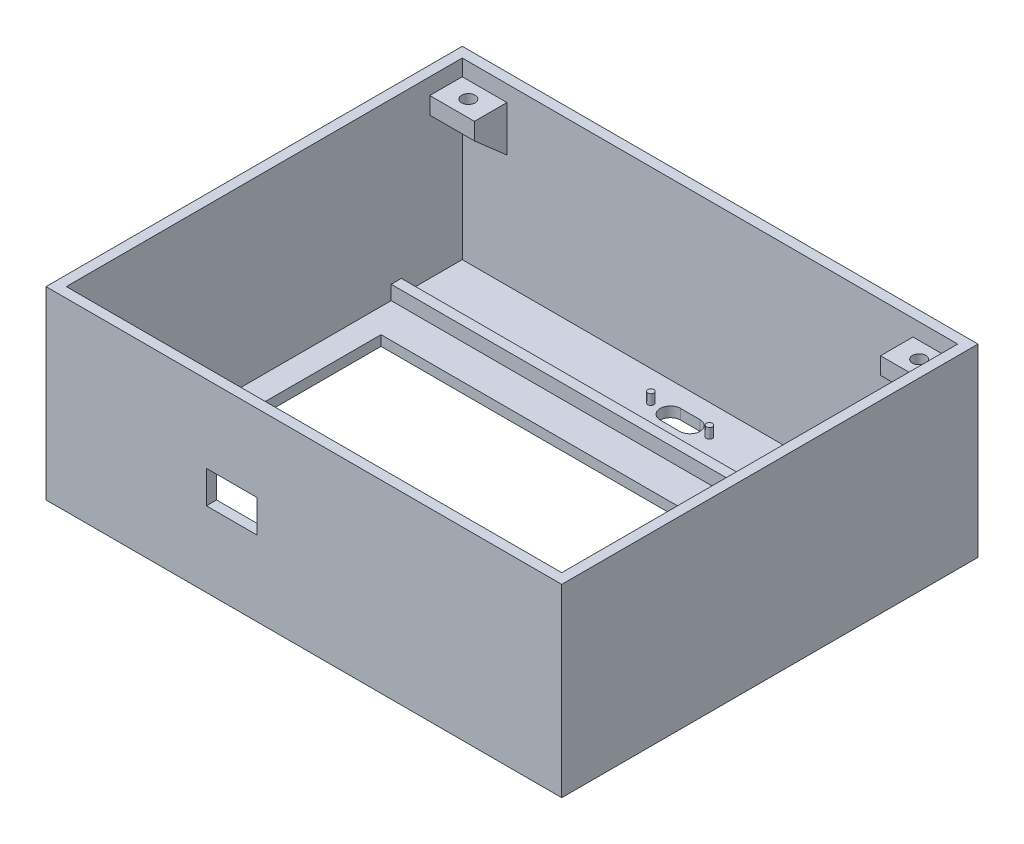
from build123d import *

# Parameters (mm, degrees)
SKETCH1_W            = 127
SKETCH1_H            = 85
BOSS_EXTRUDE1_DEPTH  = 2.5
SKETCH2_W            = 127
SKETCH2_H            = 85
SKETCH2_W_2          = 122
SKETCH2_H_2          = 80
BOSS_EXTRUDE2_DEPTH  = 38.5
SKETCH3_W            = 110
SKETCH3_H            = 68.5
CUT_EXTRUDE1_DEPTH   = 2.5
BOSS_EXTRUDE3_DEPTH  = 15
SKETCH10_W           = 122
SKETCH10_H           = 2.5
CUT_EXTRUDE2_DEPTH   = 35
SKETCH11_W           = 127
SKETCH11_H           = 41
BOSS_EXTRUDE4_DEPTH  = 2.5
CUT_EXTRUDE4_DEPTH   = 2.5
SKETCH14_W           = 15
SKETCH14_H           = 1
CUT_EXTRUDE5_DEPTH   = 1.5
SKETCH13_R           = 0.75
BOSS_EXTRUDE6_DEPTH  = 2.5
SKETCH17_W           = 12.5
SKETCH17_H           = 8
CUT_EXTRUDE6_DEPTH   = 2.5
SKETCH19_W           = 127
SKETCH19_H           = 102.5
SKETCH19_W_2         = 122
SKETCH19_H_2         = 97.5
BOSS_EXTRUDE7_DEPTH  = 4.5
SKETCH20_W           = 11
SKETCH20_H           = 4.184181858
BOSS_EXTRUDE8_DEPTH  = 8
SKETCH22_R           = 1.65
CUT_EXTRUDE7_DEPTH   = 5
BOSS_EXTRUDE9_DEPTH  = 11
BOSS_EXTRUDE10_DEPTH = 11


with BuildPart() as part:
    # Sketch1 → Boss-Extrude1 (new body)
    with BuildSketch(Plane(origin=(0, 0, 0), x_dir=(1, 0, 0), z_dir=(0, 1, 0))):
        with Locations((63.5, 42.5)):
            Rectangle(SKETCH1_W, SKETCH1_H)
    extrude(amount=BOSS_EXTRUDE1_DEPTH)

    # Sketch2 → Boss-Extrude2 (add)
    with BuildSketch(Plane(origin=(0, 2.5, 0), x_dir=(1, 0, 0), z_dir=(0, 1, 0))):
        with Locations((63.5, 42.5)):
            Rectangle(SKETCH2_W, SKETCH2_H)
        with Locations((63.5, 42.5)):
            Rectangle(SKETCH2_W_2, SKETCH2_H_2, mode=Mode.SUBTRACT)
    extrude(amount=BOSS_EXTRUDE2_DEPTH)

    # Sketch3 → Cut-Extrude1 (cut)
    with BuildSketch(Plane(origin=(0, 0, 0), x_dir=(-1, 0, 0), z_dir=(0, -1, 0))):
        with Locations((-63.5, 39.75)):
            Rectangle(SKETCH3_W, SKETCH3_H)
    extrude(amount=-CUT_EXTRUDE1_DEPTH, mode=Mode.SUBTRACT)

    # Sketch9 → Boss-Extrude3 (add)
    with BuildSketch(Plane(origin=(0, 0, -85), x_dir=(-1, 0, 0), z_dir=(0, 0, -1))):
        Polygon((-127, 0), (0, 0), (0, 2.5), (0, 41), (-2.5, 41), (-2.5, 2.5), (-124.5, 2.5), (-124.5, 41), (-127, 41), (-127, 2.5), align=None)
    extrude(amount=BOSS_EXTRUDE3_DEPTH)

    # Sketch10 → Cut-Extrude2 (cut)
    with BuildSketch(Plane(origin=(0, 41, 0), x_dir=(1, 0, 0), z_dir=(0, 1, 0))):
        with Locations((63.5, 83.75)):
            Rectangle(SKETCH10_W, SKETCH10_H)
    extrude(amount=-CUT_EXTRUDE2_DEPTH, mode=Mode.SUBTRACT)

    # Sketch11 → Boss-Extrude4 (add)
    with BuildSketch(Plane(origin=(0, 0, -100), x_dir=(-1, 0, 0), z_dir=(0, 0, -1))):
        with Locations((-63.5, 20.5)):
            Rectangle(SKETCH11_W, SKETCH11_H)
    extrude(amount=BOSS_EXTRUDE4_DEPTH)

    # Sketch6 → Cut-Extrude4 (cut)
    with BuildSketch(Plane(origin=(0, 0, 0), x_dir=(-1, 0, 0), z_dir=(0, -1, 0))):
        with BuildLine():
            Line((-61.1, 90.153713072), (-65.9, 90.153713072))
            ThreePointArc((-65.9, 90.153713072), (-68.4, 92.653713072), (-65.9, 95.153713072))
            Line((-65.9, 95.153713072), (-61.1, 95.153713072))
            ThreePointArc((-61.1, 95.153713072), (-58.6, 92.653713072), (-61.1, 90.153713072))
        make_face()
    extrude(amount=-CUT_EXTRUDE4_DEPTH, mode=Mode.SUBTRACT)

    # Sketch14 → Cut-Extrude5 (cut)
    with BuildSketch(Plane(origin=(0, 2.5, 0), x_dir=(1, 0, 0), z_dir=(0, 1, 0))):
        with Locations((63.5, 86.653713072)):
            Rectangle(SKETCH14_W, SKETCH14_H)
    extrude(amount=-CUT_EXTRUDE5_DEPTH, mode=Mode.SUBTRACT)

    # Sketch13 → Boss-Extrude6 (add)
    with BuildSketch(Plane(origin=(0, 2.5, 0), x_dir=(1, 0, 0), z_dir=(0, 1, 0))):
        with Locations((56.3, 92.653713072)):
            Circle(SKETCH13_R)
        with Locations((70.7, 92.653713072)):
            Circle(SKETCH13_R)
    extrude(amount=BOSS_EXTRUDE6_DEPTH)

    # Sketch17 → Cut-Extrude6 (cut)
    with BuildSketch(Plane.XY):
        with Locations((45.75, 22.5)):
            Rectangle(SKETCH17_W, SKETCH17_H)
    extrude(amount=-CUT_EXTRUDE6_DEPTH, mode=Mode.SUBTRACT)

    # Sketch19 → Boss-Extrude7 (add)
    with BuildSketch(Plane(origin=(0, 41, 0), x_dir=(1, 0, 0), z_dir=(0, 1, 0))):
        with Locations((63.5, 51.25)):
            Rectangle(SKETCH19_W, SKETCH19_H)
        with Locations((63.5, 51.25)):
            Rectangle(SKETCH19_W_2, SKETCH19_H_2, mode=Mode.SUBTRACT)
    extrude(amount=BOSS_EXTRUDE7_DEPTH)

    # Sketch20 → Boss-Extrude8 (add)
    with BuildSketch(Plane.XY.offset(-100)):
        with Locations((8, 39.407909071)):
            Rectangle(SKETCH20_W, SKETCH20_H)
        with Locations((119, 39.407909071)):
            Rectangle(SKETCH20_W, SKETCH20_H)
    extrude(amount=BOSS_EXTRUDE8_DEPTH)

    # Sketch22 → Cut-Extrude7 (cut)
    with BuildSketch(Plane(origin=(0, 41.5, 0), x_dir=(1, 0, 0), z_dir=(0, 1, 0))):
        with Locations((8, 96)):
            Circle(SKETCH22_R)
        with Locations((119, 96)):
            Circle(SKETCH22_R)
    extrude(amount=-CUT_EXTRUDE7_DEPTH, mode=Mode.SUBTRACT)

    # Sketch23 → Boss-Extrude9 (add)
    with BuildSketch(Plane(origin=(2.5, 0, 0), x_dir=(0, 0, -1), z_dir=(1, 0, 0))):
        Polygon((92, 37.315818142), (100, 37.315818142), (100, 30.315818142), align=None)
    extrude(amount=BOSS_EXTRUDE9_DEPTH)

    # Sketch24 → Boss-Extrude10 (add)
    with BuildSketch(Plane.ZY.offset(-124.5)):
        Polygon((-92, 37.315818142), (-100, 37.315818142), (-100, 30.315818142), align=None)
    extrude(amount=BOSS_EXTRUDE10_DEPTH)


solid = part.part
